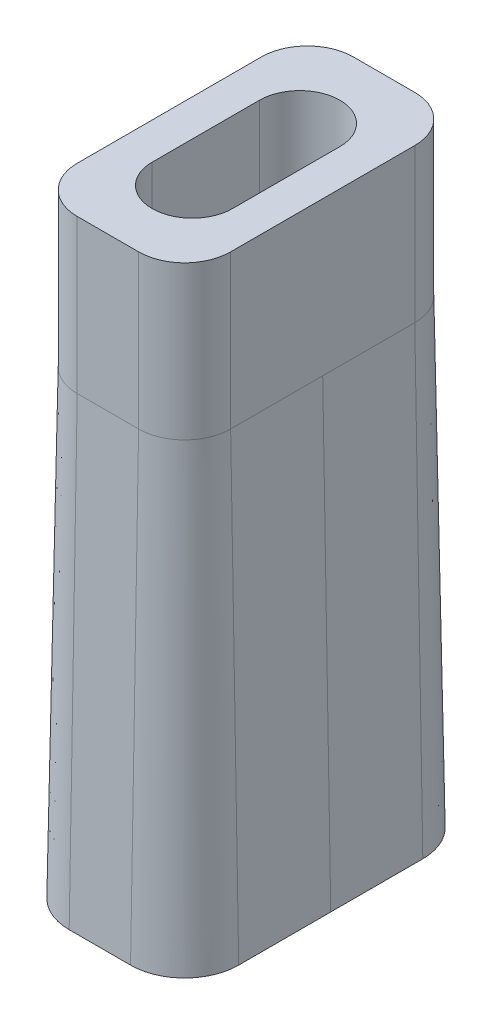
from build123d import *

# Parameters (mm, degrees)
BOSS_EXTRUDE1_DEPTH = 40
CUT_EXTRUDE2_REACH  = 43.304


with BuildPart() as part:
    # Sketch1 → Boss-Extrude1 (new body)
    with BuildSketch(Plane(origin=(0, 0, 0), x_dir=(1, 0, 0), z_dir=(0, 1, 0))):
        with BuildLine():
            Line((-2, -9), (2, -9))
            ThreePointArc((2, -9), (4.121320344, -8.121320344), (5, -6))
            Line((5, -6), (5, 6))
            ThreePointArc((5, 6), (4.121320344, 8.121320344), (2, 9))
            Line((2, 9), (-2, 9))
            ThreePointArc((-2, 9), (-4.121320344, 8.121320344), (-5, 6))
            Line((-5, 6), (-5, -6))
            ThreePointArc((-5, -6), (-4.121320344, -8.121320344), (-2, -9))
        make_face()
    extrude(amount=-BOSS_EXTRUDE1_DEPTH)

    # Sketch5 → Cut-Extrude2 (cut, up to next)
    with BuildSketch(Plane(origin=(0, 0, 0), x_dir=(1, 0, 0), z_dir=(0, 1, 0)), mode=Mode.PRIVATE) as cut_extrude2_sk1:
        with BuildLine():
            Line((-2.62, -3.5), (-2.62, 3.5))
            ThreePointArc((-2.62, 3.5), (0, 6.12), (2.62, 3.5))
            Line((2.62, 3.5), (2.62, -3.5))
            ThreePointArc((2.62, -3.5), (0, -6.12), (-2.62, -3.5))
        make_face()
    cut_extrude2_tool1 = extrude(cut_extrude2_sk1.sketch, amount=-CUT_EXTRUDE2_REACH, mode=Mode.PRIVATE) & part.part
    add(cut_extrude2_tool1.solids().sort_by_distance((0, 0, 0))[0], mode=Mode.SUBTRACT)

    # Sweep1: sweep along a path in Sketch1<3>
    with BuildLine(Plane(origin=(0, 0, 0), x_dir=(1, 0, 0), z_dir=(0, 1, 0))) as sweep1_path:
        Line((-2, -9), (2, -9))
        ThreePointArc((2, -9), (4.121320344, -8.121320344), (5, -6))
        Line((5, -6), (5, 6))
        ThreePointArc((5, 6), (4.121320344, 8.121320344), (2, 9))
        Line((2, 9), (-2, 9))
        ThreePointArc((-2, 9), (-4.121320344, 8.121320344), (-5, 6))
        Line((-5, 6), (-5, -6))
        ThreePointArc((-5, -6), (-4.121320344, -8.121320344), (-2, -9))
    # Sketch6 → Sweep1 (sweep)
    with BuildSketch(Plane.XY):
        Polygon((5, -10), (5.523651948, -40), (5, -40), align=None)
    sweep(path=sweep1_path.line)


solid = part.part
